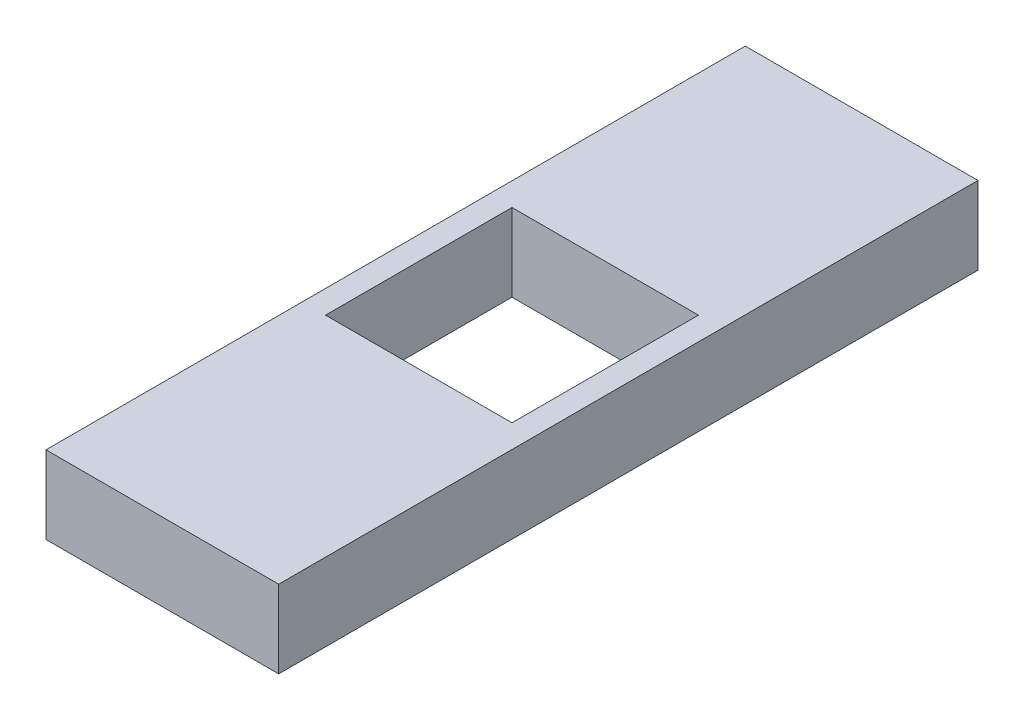
from build123d import *

# Parameters (mm, degrees)
SKETCH1_W           = 76.07554
SKETCH1_H           = 25.4
BOSS_EXTRUDE1_DEPTH = 228.6
SKETCH2_W           = 60.96
SKETCH2_H           = 60.96
CUT_EXTRUDE1_DEPTH  = 234.130847265


with BuildPart() as part:
    # Sketch1 → Boss-Extrude1 (new body)
    with BuildSketch(Plane.XY):
        Rectangle(SKETCH1_W, SKETCH1_H)
    extrude(amount=BOSS_EXTRUDE1_DEPTH)

    # Sketch2 → Cut-Extrude1 (cut, through all)
    with BuildSketch(Plane.XZ.offset(12.7)):
        with Locations((0, 114.3)):
            Rectangle(SKETCH2_W, SKETCH2_H)
    extrude(amount=-CUT_EXTRUDE1_DEPTH, mode=Mode.SUBTRACT)


solid = part.part
